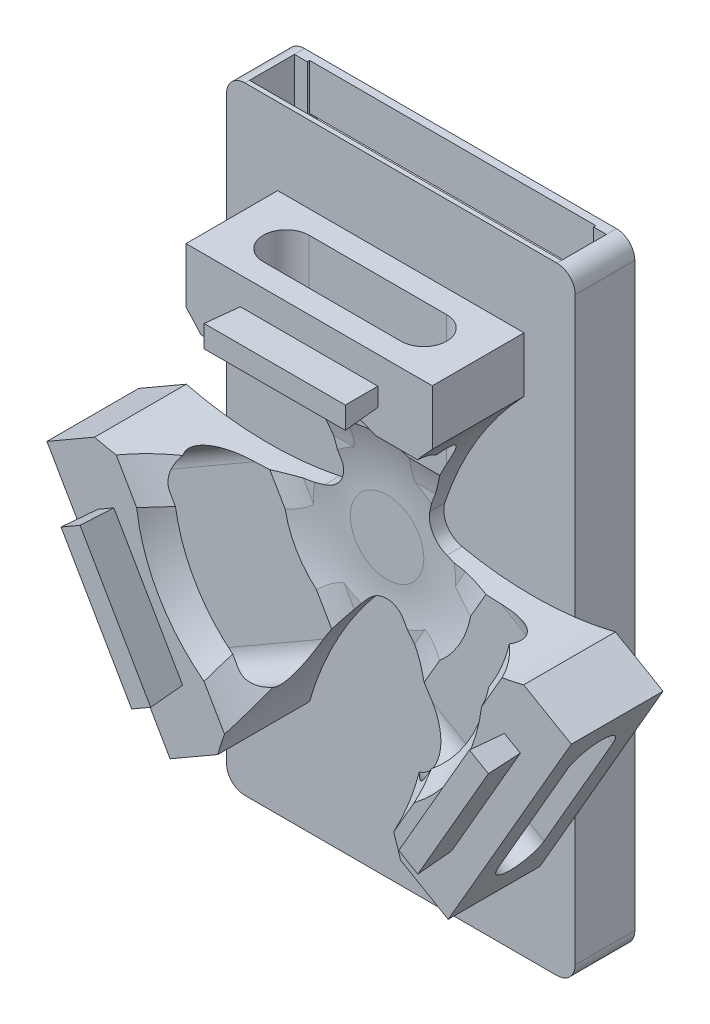
from build123d import *

# Parameters (mm, degrees)
RESSALTO_EXTRUS_O1_DEPTH           = 20
RESSALTO_EXTRUS_O2_DEPTH           = 7.5
RESSALTO_EXTRUS_O2_DRAFT           = -3
RESSALTO_EXTRUS_O2_PROFILE_2_DEPTH = 7.5
RESSALTO_EXTRUS_O2_PROFILE_2_DRAFT = -3
RESSALTO_EXTRUS_O2_PROFILE_3_DEPTH = 7.5
RESSALTO_EXTRUS_O2_PROFILE_3_DRAFT = -3
RESSALTO_EXTRUS_O3_DEPTH           = 13
CORTE_EXTRUS_O1_DEPTH              = 131
CORTE_EXTRUS_O2_DEPTH              = 60
CORTE_EXTRUS_O3_DEPTH              = 58
CORTE_EXTRUS_O4_DEPTH              = 53
ESBO_O13_W                         = 62.4
ESBO_O13_H                         = 52.25073341
ESBO_O13_H_2                       = 58.74926659
CORTE_EXTRUS_O6_DEPTH              = 3.4
CORTE_EXTRUS_O8_DEPTH              = 42
CORTE_EXTRUS_O9_DEPTH              = 42
CORTE_EXTRUS_O10_DEPTH             = 42


with BuildPart() as part:
    # Esboço1 → Ressalto-extrusão1 (new body)
    with BuildSketch(Plane.XY):
        with BuildLine():
            Line((26.846787517, 46.5), (26.846787517, 38.5))
            ThreePointArc((26.846787517, 38.5), (16.603731122, 25.147195766), (9.603000417, 9.843361122))
            ThreePointArc((9.603000417, 9.843361122), (10.024733627, 5.787782658), (13.326100999, 3.394761752))
            ThreePointArc((13.326100999, 3.394761752), (30.079975929, 1.805655066), (46.765371804, 4))
            Line((46.765371804, 4), (53.693575035, 0))
            Line((53.693575035, 0), (57.15767665, -2))
            Line((57.15767665, -2), (30.310889132, -48.5))
            Line((30.310889132, -48.5), (26.846787517, -46.5))
            Line((26.846787517, -46.5), (19.918584287, -42.5))
            ThreePointArc((19.918584287, -42.5), (13.476244807, -26.952850832), (3.723100582, -13.238122875))
            ThreePointArc((3.723100582, -13.238122875), (0, -11.575565317), (-3.723100582, -13.238122875))
            ThreePointArc((-3.723100582, -13.238122875), (-13.476244807, -26.952850832), (-19.918584287, -42.5))
            Line((-19.918584287, -42.5), (-26.846787517, -46.5))
            Line((-26.846787517, -46.5), (-30.310889132, -48.5))
            Line((-30.310889132, -48.5), (-57.15767665, -2))
            Line((-57.15767665, -2), (-53.693575035, 0))
            Line((-53.693575035, 0), (-46.765371804, 4))
            ThreePointArc((-46.765371804, 4), (-30.079975929, 1.805655066), (-13.326100999, 3.394761752))
            ThreePointArc((-13.326100999, 3.394761752), (-10.024733627, 5.787782658), (-9.603000417, 9.843361122))
            ThreePointArc((-9.603000417, 9.843361122), (-16.603731122, 25.147195766), (-26.846787517, 38.5))
            Line((-26.846787517, 38.5), (-26.846787517, 46.5))
            Line((-26.846787517, 46.5), (-26.846787517, 50.5))
            Line((-26.846787517, 50.5), (26.846787517, 50.5))
            Line((26.846787517, 50.5), (26.846787517, 46.5))
        make_face()
    extrude(amount=RESSALTO_EXTRUS_O1_DEPTH)


with BuildPart() as ressalto_extrus_o2_tool:
    # Esboço2 → Ressalto-extrusão2 (with draft: the straight prism first)
    with BuildSketch(Plane.XY.offset(20)):
        Polygon((0, 44.5), (-15, 44.5), (-15, 42), (-15, 40.5), (15, 40.5), (15, 42), (15, 44.5), align=None)
    extrude(amount=RESSALTO_EXTRUS_O2_DEPTH)
    # Ressalto-extrusão2: the draft: its side faces are tilted about the plane it starts from
    ressalto_extrus_o2_sides = [ressalto_extrus_o2_tool.faces().sort_by_distance(p)[0] for p in [
        (0, 44.5, 23.75),
        (0, 40.5, 23.75),
        (15, 42.5, 23.75),
        (-15, 42.5, 23.75),
    ]]
    draft(ressalto_extrus_o2_sides, Plane.XY.offset(20), RESSALTO_EXTRUS_O2_DRAFT)


with BuildPart() as part_1:
    add(part.part)

    # Ressalto-extrusão2: add ressalto_extrus_o2_tool
    add(ressalto_extrus_o2_tool.part)


with BuildPart() as ressalto_extrus_o2_profile_2_tool:
    # Esboço2 → Ressalto-extrusão2 profile 2 (with draft: the straight prism first)
    with BuildSketch(Plane.XY.offset(20)):
        Polygon((-38.538130468, -22.25), (-31.038130468, -35.240381057), (-28.873066959, -33.990381057), (-27.574028853, -33.240381057), (-42.574028853, -7.259618943), (-43.873066959, -8.009618943), (-46.038130468, -9.259618943), align=None)
    extrude(amount=RESSALTO_EXTRUS_O2_PROFILE_2_DEPTH)
    # Ressalto-extrusão2 profile 2: the draft: its side faces are tilted about the plane it starts from
    ressalto_extrus_o2_profile_2_sides = [ressalto_extrus_o2_profile_2_tool.faces().sort_by_distance(p)[0] for p in [
        (-38.538130468, -22.25, 23.75),
        (-35.074028853, -20.25, 23.75),
        (-44.306079661, -8.259618943, 23.75),
        (-29.306079661, -34.240381057, 23.75),
    ]]
    draft(ressalto_extrus_o2_profile_2_sides, Plane.XY.offset(20), RESSALTO_EXTRUS_O2_PROFILE_2_DRAFT)


with BuildPart() as part_2:
    add(part_1.part)

    # Ressalto-extrusão2 profile 2: add ressalto_extrus_o2_profile_2_tool
    add(ressalto_extrus_o2_profile_2_tool.part)


with BuildPart() as ressalto_extrus_o2_profile_3_tool:
    # Esboço2 → Ressalto-extrusão2 profile 3 (with draft: the straight prism first)
    with BuildSketch(Plane.XY.offset(20)):
        Polygon((38.538130468, -22.25), (46.038130468, -9.259618943), (43.873066959, -8.009618943), (42.574028853, -7.259618943), (27.574028853, -33.240381057), (28.873066959, -33.990381057), (31.038130468, -35.240381057), align=None)
    extrude(amount=RESSALTO_EXTRUS_O2_PROFILE_3_DEPTH)
    # Ressalto-extrusão2 profile 3: the draft: its side faces are tilted about the plane it starts from
    ressalto_extrus_o2_profile_3_sides = [ressalto_extrus_o2_profile_3_tool.faces().sort_by_distance(p)[0] for p in [
        (38.538130468, -22.25, 23.75),
        (35.074028853, -20.25, 23.75),
        (29.306079661, -34.240381057, 23.75),
        (44.306079661, -8.259618943, 23.75),
    ]]
    draft(ressalto_extrus_o2_profile_3_sides, Plane.XY.offset(20), RESSALTO_EXTRUS_O2_PROFILE_3_DRAFT)


with BuildPart() as part_3:
    add(part_2.part)

    # Ressalto-extrusão2 profile 3: add ressalto_extrus_o2_profile_3_tool
    add(ressalto_extrus_o2_profile_3_tool.part)

    # Esboço3 → Ressalto-extrusão3 (add)
    with BuildSketch(Plane(origin=(0, 0, 0), x_dir=(-1, 0, 0), z_dir=(0, 0, -1))):
        with BuildLine():
            Line((38, 63.25073341), (38, -63.25073341))
            ThreePointArc((38, -63.25073341), (36.828427125, -66.079160535), (34, -67.25073341))
            Line((34, -67.25073341), (-34, -67.25073341))
            ThreePointArc((-34, -67.25073341), (-36.828427125, -66.079160535), (-38, -63.25073341))
            Line((-38, -63.25073341), (-38, 63.25073341))
            ThreePointArc((-38, 63.25073341), (-36.828427125, 66.079160535), (-34, 67.25073341))
            Line((-34, 67.25073341), (34, 67.25073341))
            ThreePointArc((34, 67.25073341), (36.828427125, 66.079160535), (38, 63.25073341))
        make_face()
    extrude(amount=RESSALTO_EXTRUS_O3_DEPTH)

    # Esboço4 → Corte-extrusão1 (cut)
    with BuildSketch(Plane(origin=(0, 67.25073341, 0), x_dir=(1, 0, 0), z_dir=(0, 1, 0))):
        Polygon((0, 1), (34, 1), (34, 10.8), (31.2, 10.8), (31.2, 11.3), (-31.2, 11.3), (-31.2, 10.8), (-34, 10.8), (-34, 1), align=None)
    extrude(amount=-CORTE_EXTRUS_O1_DEPTH, mode=Mode.SUBTRACT)

    # Esboço6 → Corte-extrusão2 (cut)
    with BuildSketch(Plane.ZY.offset(26.846787517)):
        with BuildLine():
            Line((20.043536298, 34.944688344), (31.559873949, 34.944688344))
            Line((31.559873949, 34.944688344), (21.222643852, 4))
            Line((21.222643852, 4), (3.576332881, 4))
            Line((3.576332881, 4), (3.576332881, 14))
            ThreePointArc((3.576332881, 14), (9.0656388, 26.629973651), (20.043536298, 34.944688344))
        make_face()
    extrude(amount=-CORTE_EXTRUS_O2_DEPTH, mode=Mode.SUBTRACT)

    # Esboço8 → Corte-extrusão3 (cut)
    with BuildSketch(Plane(origin=(13.423393759, -23.25, 0), x_dir=(0.8660254037844386, 0.5000000000000003, 0), z_dir=(0.5000000000000003, -0.8660254037844386, 0))):
        with BuildLine():
            Line((-34.944688344, 20.043536298), (-34.944688344, 31.559873949))
            Line((-34.944688344, 31.559873949), (-4, 21.222643852))
            Line((-4, 21.222643852), (-4, 3.576332881))
            Line((-4, 3.576332881), (-14, 3.576332881))
            ThreePointArc((-14, 3.576332881), (-26.629973651, 9.0656388), (-34.944688344, 20.043536298))
        make_face()
    extrude(amount=-CORTE_EXTRUS_O3_DEPTH, mode=Mode.SUBTRACT)

    # Esboço10 → Corte-extrusão4 (cut)
    with BuildSketch(Plane(origin=(13.423393759, 23.25, 0), x_dir=(0.8660254037845888, -0.4999999999997399, 0), z_dir=(0.49999999999973993, 0.8660254037845889, 0))):
        with BuildLine():
            Line((34.944688344, -20.043536298), (34.944688344, -31.559873949))
            Line((34.944688344, -31.559873949), (4, -21.222643852))
            Line((4, -21.222643852), (4, -3.576332881))
            Line((4, -3.576332881), (14, -3.576332881))
            ThreePointArc((14, -3.576332881), (26.629973651, -9.0656388), (34.944688344, -20.043536298))
        make_face()
    extrude(amount=-CORTE_EXTRUS_O4_DEPTH, mode=Mode.SUBTRACT)

    # Esboço15 → Corte-Revolução2 (revolve, cut)
    with BuildSketch(Plane(origin=(0, 0, 0), x_dir=(0, 0, -1), z_dir=(1, 0, 0))):
        with BuildLine():
            Line((-62.750540435, 37.887859662), (-62.750540435, 34.887859662))
            Line((-62.750540435, 34.887859662), (-62.750540435, 0))
            Line((-62.750540435, 0), (-3, 0))
            Line((-3, 0), (-3, 8))
            ThreePointArc((-3, 8), (-7.235534787, 25.369527028), (-20, 37.887859662))
            Line((-20, 37.887859662), (-62.750540435, 37.887859662))
        make_face()
    revolve(axis=Axis((0, 0, 3), (0, 0, 1)), mode=Mode.SUBTRACT)

    # Esboço13 → Corte-extrusão6 (cut)
    with BuildSketch(Plane(origin=(0, 0, -13), x_dir=(-1, 0, 0), z_dir=(0, 0, -1))):
        with Locations((0, 31.125366705)):
            Rectangle(ESBO_O13_W, ESBO_O13_H)
        with Locations((0, -34.374633295)):
            Rectangle(ESBO_O13_W, ESBO_O13_H_2)
    extrude(amount=-CORTE_EXTRUS_O6_DEPTH, mode=Mode.SUBTRACT)

    # Esboço16 → Corte-extrusão8 (cut)
    with BuildSketch(Plane(origin=(-43.734282891, -25.25, 0), x_dir=(0, 0, 1), z_dir=(-0.8660254037844364, -0.5000000000000041, 0))):
        with BuildLine():
            Line((5, -15), (5, 15))
            ThreePointArc((5, 15), (10, 20), (15, 15))
            Line((15, 15), (15, -15))
            ThreePointArc((15, -15), (10, -20), (5, -15))
        make_face()
    extrude(amount=-CORTE_EXTRUS_O8_DEPTH, mode=Mode.SUBTRACT)

    # Esboço18 → Corte-extrusão9 (cut)
    with BuildSketch(Plane(origin=(43.734282891, -25.25, 0), x_dir=(0, 0, -1), z_dir=(0.8660254037844364, -0.5000000000000041, 0))):
        with BuildLine():
            Line((-5, 15), (-5, -15))
            ThreePointArc((-5, -15), (-10, -20), (-15, -15))
            Line((-15, -15), (-15, 15))
            ThreePointArc((-15, 15), (-10, 20), (-5, 15))
        make_face()
    extrude(amount=-CORTE_EXTRUS_O9_DEPTH, mode=Mode.SUBTRACT)

    # Esboço19 → Corte-extrusão10 (cut)
    with BuildSketch(Plane(origin=(0, 50.5, 0), x_dir=(1, 0, 0), z_dir=(0, 1, 0))):
        with BuildLine():
            Line((-15, -5), (15, -5))
            ThreePointArc((15, -5), (20, -10), (15, -15))
            Line((15, -15), (-15, -15))
            ThreePointArc((-15, -15), (-20, -10), (-15, -5))
        make_face()
    extrude(amount=-CORTE_EXTRUS_O10_DEPTH, mode=Mode.SUBTRACT)


solid = part_3.part
